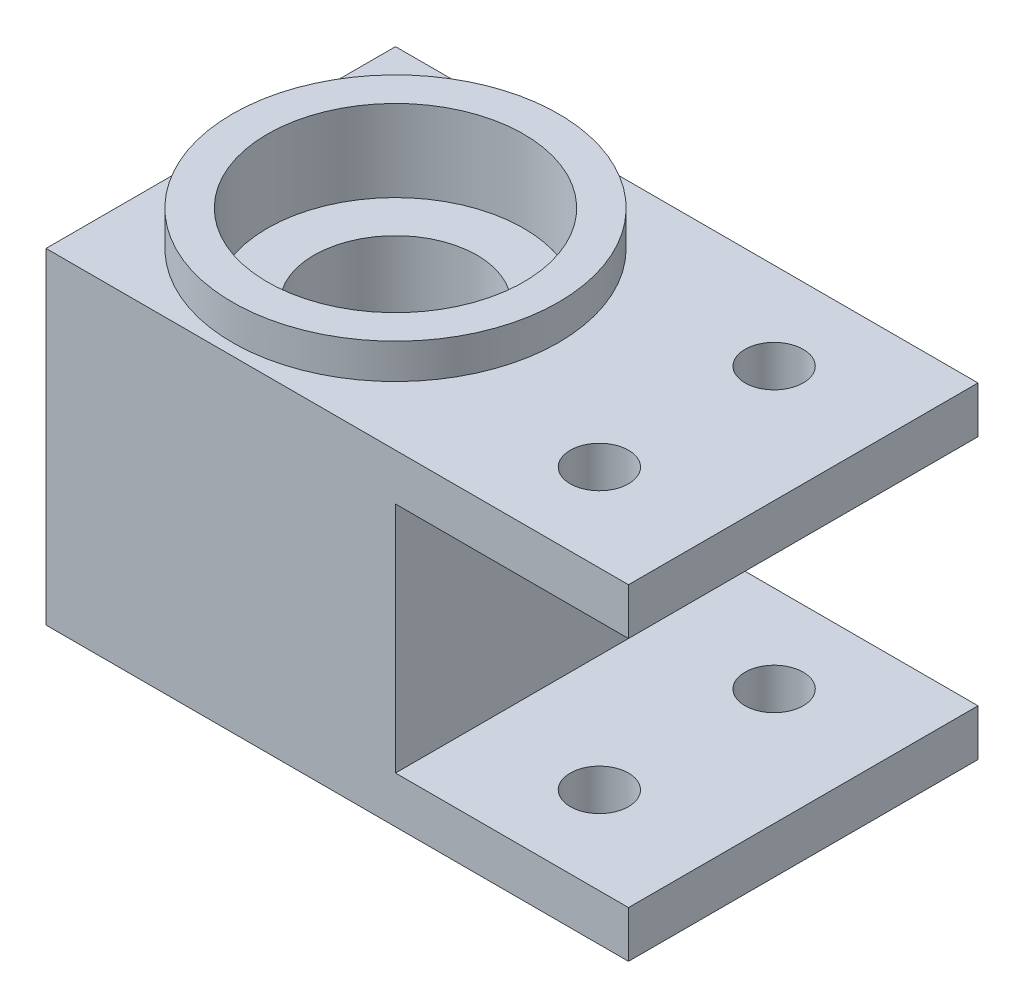
from build123d import *

# Parameters (mm, degrees)
BOSS_EXTRUDE1_DEPTH = 30
SKETCH2_R           = 7
CUT_EXTRUDE1_DEPTH  = 58.306195128
SKETCH3_R           = 11
CUT_EXTRUDE2_DEPTH  = 4
CUT_EXTRUDE3_START  = -7
SKETCH4_R           = 11
CUT_EXTRUDE3_DEPTH  = 7
SKETCH5_R           = 2.5
CUT_EXTRUDE4_DEPTH  = 58.306195128
BOSS_EXTRUDE2_START = 3
SKETCH6_R           = 14
SKETCH6_R_2         = 11
BOSS_EXTRUDE2_DEPTH = 3


with BuildPart() as part:
    # Sketch1 → Boss-Extrude1 (new body)
    with BuildSketch(Plane.XY):
        Polygon((10, 10), (10, 14), (-40, 14), (-40, -14), (10, -14), (10, -10), (-10, -10), (-10, 10), align=None)
    extrude(amount=BOSS_EXTRUDE1_DEPTH)

    # Sketch2 → Cut-Extrude1 (cut, through all)
    with BuildSketch(Plane(origin=(0, 14, 0), x_dir=(1, 0, 0), z_dir=(0, 1, 0))):
        with Locations((-25, -15)):
            Circle(SKETCH2_R)
    extrude(amount=-CUT_EXTRUDE1_DEPTH, mode=Mode.SUBTRACT)

    # Sketch3 → Cut-Extrude2 (cut)
    with BuildSketch(Plane(origin=(0, 14, 0), x_dir=(1, 0, 0), z_dir=(0, 1, 0))):
        with Locations((-25, -15)):
            Circle(SKETCH3_R)
    extrude(amount=-CUT_EXTRUDE2_DEPTH, mode=Mode.SUBTRACT)

    # Sketch4 → Cut-Extrude3 (cut)
    with BuildSketch(Plane.XZ.offset(14).offset(CUT_EXTRUDE3_START)):
        with Locations((-25, 15)):
            Circle(SKETCH4_R)
    extrude(amount=CUT_EXTRUDE3_DEPTH, mode=Mode.SUBTRACT)

    # Sketch5 → Cut-Extrude4 (cut, through all)
    with BuildSketch(Plane(origin=(0, 14, 0), x_dir=(1, 0, 0), z_dir=(0, 1, 0))):
        with Locations((0, -7.5)):
            Circle(SKETCH5_R)
        with Locations((0, -22.5)):
            Circle(SKETCH5_R)
    extrude(amount=-CUT_EXTRUDE4_DEPTH, mode=Mode.SUBTRACT)

    # Sketch6 → Boss-Extrude2 (add)
    with BuildSketch(Plane(origin=(0, 14, 0), x_dir=(1, 0, 0), z_dir=(0, 1, 0)).offset(BOSS_EXTRUDE2_START)):
        with Locations((-25, -15)):
            Circle(SKETCH6_R)
        with Locations((-25, -15)):
            Circle(SKETCH6_R_2, mode=Mode.SUBTRACT)
    extrude(amount=-BOSS_EXTRUDE2_DEPTH)


solid = part.part
